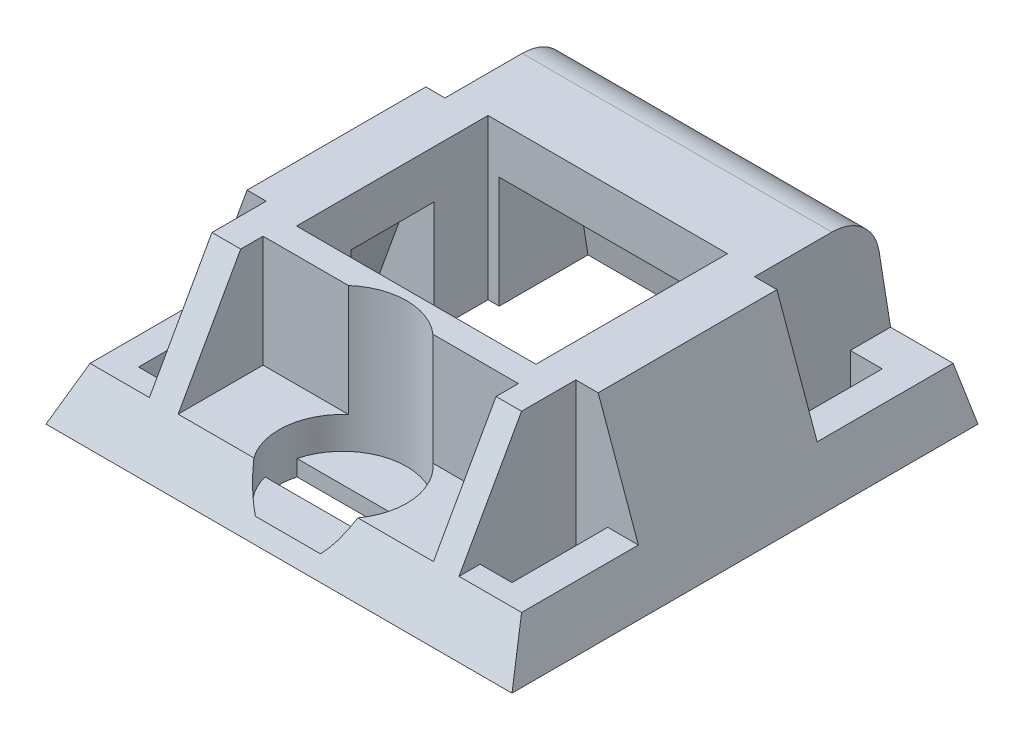
from build123d import *

# Parameters (mm, degrees)
FILLET1_R               = 1.5
SKETCH4_W               = 2.4
SKETCH4_H               = 4.5
SKETCH4_W_2             = 2.5
SKETCH4_W_3             = 8
SKETCH4_H_2             = 3.5
CUT_EXTRUDE1_DEPTH      = 3.5
SKETCH3_W               = 7.5
SKETCH3_H               = 6
CUT_EXTRUDE2_DEPTH      = 12.470832747
CUT_EXTRUDE5_DEPTH      = 11.900917559
CUT_EXTRUDE5_DEPTH_BACK = 1
SKETCH5_R               = 2
CUT_EXTRUDE6_START      = -0.5
CUT_EXTRUDE6_DEPTH      = 1.5
SKETCH9_W               = 1
SKETCH9_H               = 3
CUT_EXTRUDE9_DEPTH      = 12.470832747


with BuildPart() as part:
    # Sketch1 → Loft1 section 0
    with BuildSketch(Plane(origin=(0, 0, 0), x_dir=(1, 0, 0), z_dir=(0, 1, 0))):
        with BuildLine():
            Line((-7.3, 7.3), (7.3, 7.3))
            Line((7.3, 7.3), (7.3, -7.3))
            Line((7.3, -7.3), (-7.3, -7.3))
            Line((-7.3, -7.3), (-7.3, 7.3))
        make_face()
    # Sketch2 → Loft1 section 1
    with BuildSketch(Plane(origin=(0, 5, 0), x_dir=(1, 0, 0), z_dir=(0, 1, 0))):
        with BuildLine():
            Line((-5.5, 6.5), (5.5, 6.5))
            Line((5.5, 6.5), (5.5, -4.5))
            Line((5.5, -4.5), (-5.5, -4.5))
            Line((-5.5, -4.5), (-5.5, 6.5))
        make_face()
    loft()

    # Fillet1
    fillet1_edges = [part.edges().sort_by_distance(p)[0] for p in [
        (0, 5, -6.5),
    ]]
    fillet(fillet1_edges, radius=FILLET1_R)

    # Sketch4 → Cut-Extrude1 (cut)
    with BuildSketch(Plane(origin=(0, 5, 0), x_dir=(1, 0, 0), z_dir=(0, 1, 0))):
        with Locations((-6.1, -5.05)):
            Rectangle(SKETCH4_W, SKETCH4_H)
        with Locations((6.05, 5.05)):
            Rectangle(SKETCH4_W_2, SKETCH4_H)
        with Locations((-6.1, 5.05)):
            Rectangle(SKETCH4_W, SKETCH4_H)
        with Locations((6.05, -5.05)):
            Rectangle(SKETCH4_W_2, SKETCH4_H)
        with Locations((0, -5.55)):
            Rectangle(SKETCH4_W_3, SKETCH4_H_2)
    extrude(amount=-CUT_EXTRUDE1_DEPTH, mode=Mode.SUBTRACT)

    # Shell2: read off the stored shape, not the designer's step
    # Shell2: loft between two sections, ruled curve by curve
    shell2_from = [
        Edge.make_line((5.705760369, 0, 1.3), (5.705760369, 0, -1.3)),
        Edge.make_line((-3.4, 0, -5.780921332), (3.3, 0, -5.780921332)),
        Edge.make_line((-5.705760369, 0, 1.3), (-5.705760369, 0, -1.3)),
        Edge.make_line((5.705760369, 0, -1.3), (3.3, 0, -1.3)),
        Edge.make_line((-5.705760369, 0, -1.3), (-3.4, 0, -1.3)),
        Edge.make_line((3.3, 0, -5.780921332), (3.3, 0, -1.3)),
        Edge.make_line((3.3, 0, 1.3), (3.3, 0, 2.3)),
        Edge.make_line((-3.4, 0, -5.780921332), (-3.4, 0, -1.3)),
        Edge.make_line((-3.4, 0, 2.3), (-3.4, 0, 1.3)),
        Edge.make_line((-3.4, 0, 1.3), (-5.705760369, 0, 1.3)),
        Edge.make_line((5.705760369, 0, 1.3), (3.3, 0, 1.3)),
        Edge.make_line((3.3, 0, 2.3), (-3.4, 0, 2.3)),
    ]
    shell2_to = [
        Edge.make_line((4.445760369, 3.5, 1.3), (4.445760369, 3.5, -1.3)),
        Edge.make_line((-3.4, 3.5, -5.220921332), (3.3, 3.5, -5.220921332)),
        Edge.make_line((-4.445760369, 3.5, 1.3), (-4.445760369, 3.5, -1.3)),
        Edge.make_line((4.445760369, 3.5, -1.3), (3.3, 3.5, -1.3)),
        Edge.make_line((-4.445760369, 3.5, -1.3), (-3.4, 3.5, -1.3)),
        Edge.make_line((3.3, 3.5, -5.220921332), (3.3, 3.5, -1.3)),
        Edge.make_line((3.3, 3.5, 1.3), (3.3, 3.5, 2.3)),
        Edge.make_line((-3.4, 3.5, -5.220921332), (-3.4, 3.5, -1.3)),
        Edge.make_line((-3.4, 3.5, 2.3), (-3.4, 3.5, 1.3)),
        Edge.make_line((-3.4, 3.5, 1.3), (-4.445760369, 3.5, 1.3)),
        Edge.make_line((4.445760369, 3.5, 1.3), (3.3, 3.5, 1.3)),
        Edge.make_line((3.3, 3.5, 2.3), (-3.4, 3.5, 2.3)),
    ]
    shell2 = Solid(Shell([*[Face.make_surface_from_curves(shell2_from[k], shell2_to[k]) for k in range(12)], Face(Wire(shell2_from)), Face(Wire(shell2_to))]))
    add(shell2, mode=Mode.SUBTRACT)

    # Sketch3 → Cut-Extrude2 (cut, through all)
    with BuildSketch(Plane.XZ):
        Rectangle(SKETCH3_W, SKETCH3_H)
    extrude(amount=-CUT_EXTRUDE2_DEPTH, mode=Mode.SUBTRACT)

    # Sketch5 → Cut-Extrude5 (cut, two sides: drawn at the far end of the back side and taken through both)
    with BuildSketch(Plane(origin=(0, 1.5, 0), x_dir=(1, 0, 0), z_dir=(0, 1, 0)).offset(-CUT_EXTRUDE5_DEPTH_BACK)):
        with Locations((0, -5.3)):
            Circle(SKETCH5_R)
    extrude(amount=CUT_EXTRUDE5_DEPTH + CUT_EXTRUDE5_DEPTH_BACK, mode=Mode.SUBTRACT)

    # Cut-Extrude6: read off the stored shape, not the designer's step
    # Cut-Extrude6 outline → Cut-Extrude6 (cut)
    with BuildSketch(Plane.XZ.offset(CUT_EXTRUDE6_START)):
        with BuildLine():
            Line((1.936491673, 5.8), (-1.936491673, 5.8))
            ThreePointArc((-1.936491673, 5.8), (-2, 5.3), (-1.936491673, 4.8))
            Line((-1.936491673, 4.8), (1.936491673, 4.8))
            ThreePointArc((1.936491673, 4.8), (2, 5.3), (1.936491673, 5.8))
        make_face()
    extrude(amount=CUT_EXTRUDE6_DEPTH, mode=Mode.SUBTRACT)

    # Sketch9 → Cut-Extrude9 (cut, through all)
    with BuildSketch(Plane(origin=(0, 0, 0), x_dir=(1, 0, 0), z_dir=(0, 1, 0))):
        with Locations((-5.4, 4.3)):
            Rectangle(SKETCH9_W, SKETCH9_H)
        with Locations((5.3, 4.3)):
            Rectangle(SKETCH9_W, SKETCH9_H)
        with Locations((-5.4, -4.3)):
            Rectangle(SKETCH9_W, SKETCH9_H)
        with Locations((5.3, -4.3)):
            Rectangle(SKETCH9_W, SKETCH9_H)
    extrude(amount=CUT_EXTRUDE9_DEPTH, mode=Mode.SUBTRACT)


solid = part.part
